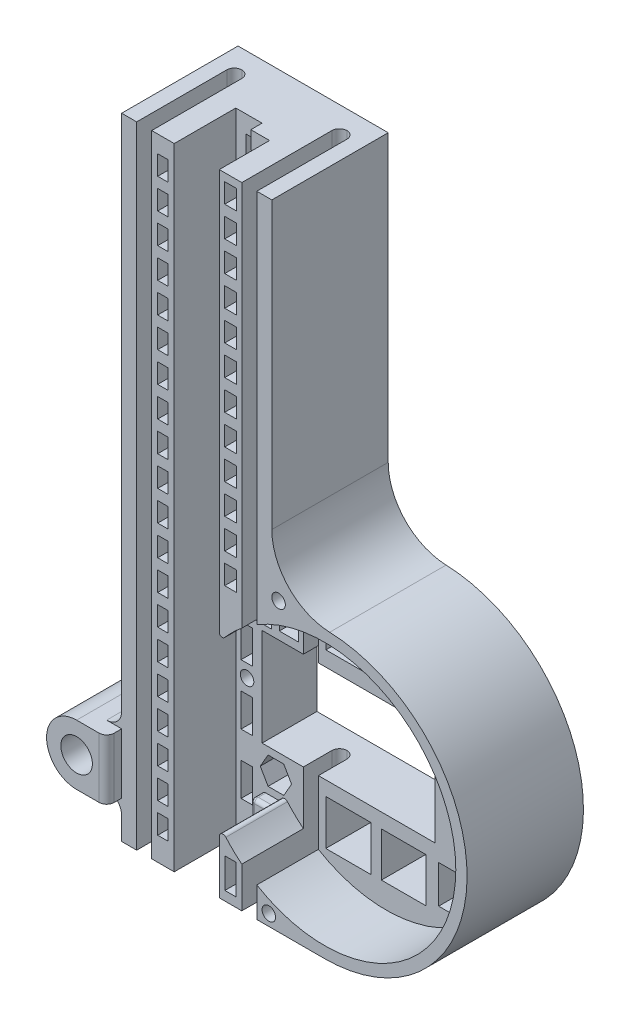
from build123d import *

# Parameters (mm, degrees)
BODYBASE_R                            = 19
BODY_DEPTH                            = 7.75
SERVOLOCH_W                           = 23
SERVOLOCH_H                           = 13
SERVO_LOCH_DEPTH                      = 73.974310548
ZAHRADLAUF_R                          = 17.5
ZAHNRAD_LAUF_DEPTH                    = 8.2
ZAHNSTANGENLAUF_W                     = 6
ZAHNSTANGENLAUF_H                     = 85
ZAHNSTANGEN_LAUF_DEPTH                = 8.2
SKIZZE5_W                             = 2.5
SKIZZE5_H                             = 7
FRONTFUEHRUNG_DEPTH                   = 1.5
SKIZZE2_W                             = 2.5
SKIZZE2_H                             = 53.958746969
AUFSATZ_LINEAR_AUSTRAGEN2_DEPTH       = 1.5
VERRUNDUNG22_R                        = 0.5
VERRUNDUNG13_R                        = 8
SKIZZEFURCHE_W                        = 2
SKIZZEFURCHE_H                        = 85
FURCHE_DEPTH                          = 13
GEGENSTUCKINNEN_W                     = 2
GEGENSTUCKINNEN_H                     = 4.6
GEGENSTUCK_INNEN_DEPTH                = 8
LINEARES_MUSTER1_COUNT                = 3
LINEARES_MUSTER1_PITCH                = 10
ANSATZ_DEPTH                          = 7.75
VERRUNDUNG14_R                        = 2
GEGENSTUCK2_W                         = 2
GEGENSTUCK2_H                         = 4.6
GEGENSTUCKAUSSEN_DEPTH                = 8
BUCKELMUSTER2_COUNT                   = 6
BUCKELMUSTER2_PITCH                   = 10
VERRUNDUNG15_R                        = 2
VERRUNDUNG21_R                        = 0.5
BOHRUNG_OBEN_R                        = 0.9
BOHRLOCHER_OBEN_DEPTH                 = 10
SKIZZE11_W                            = 1.4
SKIZZE11_H                            = 2.6
SCHNITT_LINEAR_AUSTRAGEN5_DEPTH       = 15
LINEARES_MUSTER3_COUNT                = 20
LINEARES_MUSTER3_PITCH                = 4
ANSATZ_OBEN_DEPTH                     = 2
VERRUNDUNG23_R                        = 2
VERRUNDUNG24_R                        = 2
VERRUNDUNG25_R                        = 1
SKIZZE16_R                            = 2.1
AUSSENBORDER_DEPTH                    = 77.728417315
SKIZZE17_W                            = 3.4
SKIZZE17_H                            = 2.6
SCHNITT_LINEAR_AUSTRAGEN7_DEPTH       = 8
LINEARES_MUSTER5_COUNT                = 13
LINEARES_MUSTER5_PITCH                = 4.4
SKIZZE18_W                            = 1.552843638
SKIZZE18_H                            = 2.6
SCHNITT_LINEAR_AUSTRAGEN8_DEPTH       = 14
LINEARES_MUSTER6_COUNT                = 12
LINEARES_MUSTER6_PITCH                = 4
SCHNITT_LINEAR_AUSTRAGEN10_DEPTH      = 6
VERRUNDUNG27_R                        = 0.4
VERRUNDUNG28_R                        = 0.4
SKIZZE24_W                            = 1.5
SKIZZE24_H                            = 4.4
SCHNITT_LINEAR_AUSTRAGEN11_DEPTH      = 6
LINEARES_MUSTER7_COUNT                = 3
LINEARES_MUSTER7_PITCH                = 8
VERRUNDUNG31_R                        = 1
VERRUNDUNG32_R                        = 1
VERRUNDUNG33_R                        = 1
VERRUNDUNG34_R                        = 1
VERRUNDUNG35_R                        = 1
SKIZZE26_W                            = 1.5
SKIZZE26_H                            = 4
SCHNITT_LINEAR_AUSTRAGEN13_DEPTH      = 13
SCHNITT_LINEAR_AUSTRAGEN14_DEPTH      = 77.728417292
SCHNITT_LINEAR_AUSTRAGEN14_DEPTH_BACK = 77.728417292
SKIZZE27_R                            = 0.9
VERRUNDUNG30_R                        = 0.5
SKIZZE29_W                            = 6
SKIZZE29_H                            = 6
SKIZZE29_W_2                          = 5.560018303
SKIZZE29_H_2                          = 6.236802283
SKIZZE29_W_3                          = 3.76587695
SKIZZE29_H_3                          = 4.832158239
SKIZZE29_W_4                          = 5.942855049
SKIZZE29_H_4                          = 5.908583954
SKIZZE29_W_5                          = 3.227027913
SKIZZE29_H_5                          = 5.038233608
SKIZZE29_W_6                          = 4.415287799
SKIZZE29_H_6                          = 13.001496805
SCHNITT_LINEAR_AUSTRAGEN15_DEPTH      = 6
SKIZZE30_W                            = 2.55244911
SKIZZE30_H                            = 2.728202153
SCHNITT_LINEAR_AUSTRAGEN16_DEPTH      = 7
SKIZZE31_W                            = 20
SKIZZE31_H                            = 1
SCHNITT_LINEAR_AUSTRAGEN17_DEPTH      = 77.297116743


with BuildPart() as part:
    # BodyBase → body (new, symmetric)
    with BuildSketch(Plane.XY):
        with BuildLine():
            Line((-7, 66), (-27, 66))
            Line((-27, 66), (-27, -19))
            Line((-27, -19), (0, -19))
            ThreePointArc((0, -19), (-19, 0), (0, 19))
            Line((0, 19), (-7, 19))
            Line((-7, 19), (-7, 66))
        make_face()
        Circle(BODYBASE_R)
    extrude(amount=BODY_DEPTH, both=True)

    # ServoLoch → servo_loch (cut, through all)
    with BuildSketch(Plane.XY.offset(7.75)):
        with Locations((-5, 0)):
            Rectangle(SERVOLOCH_W, SERVOLOCH_H)
    extrude(amount=-SERVO_LOCH_DEPTH, mode=Mode.SUBTRACT)

    # Zahradlauf → zahnrad_lauf (cut)
    with BuildSketch(Plane.XY.offset(7.75)):
        Circle(ZAHRADLAUF_R)
    extrude(amount=-ZAHNRAD_LAUF_DEPTH, mode=Mode.SUBTRACT)

    # zahnstangenlauf → zahnstangen_lauf (cut)
    with BuildSketch(Plane.XY.offset(7.75)):
        with Locations((-17, 23.5)):
            Rectangle(ZAHNSTANGENLAUF_W, ZAHNSTANGENLAUF_H)
    extrude(amount=-ZAHNSTANGEN_LAUF_DEPTH, mode=Mode.SUBTRACT)

    # Skizze5 → frontfuehrung (add)
    with BuildSketch(Plane.XY.offset(-0.45)):
        with Locations((-15.25, -15.5)):
            Rectangle(SKIZZE5_W, SKIZZE5_H)
    extrude(amount=FRONTFUEHRUNG_DEPTH)

    # Skizze2 → Aufsatz-Linear austragen2 (add)
    with BuildSketch(Plane.XY.offset(-0.45)):
        with Locations((-15.25, 39.020626515)):
            Rectangle(SKIZZE2_W, SKIZZE2_H)
    extrude(amount=AUFSATZ_LINEAR_AUSTRAGEN2_DEPTH)

    # Verrundung22
    verrundung22_edges = [part.edges().sort_by_distance(p)[0] for p in [
        (-14, -10.5, 3.65),
    ]]
    fillet(verrundung22_edges, radius=VERRUNDUNG22_R)

    # Verrundung13
    verrundung13_edges = [part.edges().sort_by_distance(p)[0] for p in [
        (-7, 19, 0),
    ]]
    fillet(verrundung13_edges, radius=VERRUNDUNG13_R)

    # SkizzeFurche → Furche (cut)
    with BuildSketch(Plane.XY.offset(7.75)):
        with Locations((-24, 23.5)):
            Rectangle(SKIZZEFURCHE_W, SKIZZEFURCHE_H)
        with Locations((-10, 23.5)):
            Rectangle(SKIZZEFURCHE_W, SKIZZEFURCHE_H)
    extrude(amount=-FURCHE_DEPTH, mode=Mode.SUBTRACT)

    # gegenstuckInnen → gegenstuck innen (add)
    with BuildSketch(Plane.XY.offset(-5.25)):
        with Locations((-10, 43.34)):
            Rectangle(GEGENSTUCKINNEN_W, GEGENSTUCKINNEN_H)
    gegenstuck_innen = extrude(amount=GEGENSTUCK_INNEN_DEPTH)

    # Lineares Muster1: gegenstuck innen ×3
    with Locations(*[(0, -i * LINEARES_MUSTER1_PITCH, 0) for i in range(1, LINEARES_MUSTER1_COUNT)]):
        add(gegenstuck_innen)

    # Verrundung14
    verrundung14_edges = [part.edges().sort_by_distance(p)[0] for p in [
        (-10, 41.04, 2.75),
        (-10, 45.64, 2.75),
        (-10, 31.04, 2.75),
        (-10, 35.64, 2.75),
        (-10, 21.04, 2.75),
        (-10, 25.64, 2.75),
    ]]
    fillet(verrundung14_edges, radius=VERRUNDUNG14_R)

    # gegenstuck2 → gegenstuckAussen (add)
    with BuildSketch(Plane.XY.offset(-5.25)):
        with Locations((-24, 43.55)):
            Rectangle(GEGENSTUCK2_W, GEGENSTUCK2_H)
    gegenstuckaussen = extrude(amount=GEGENSTUCKAUSSEN_DEPTH)

    # buckelmuster2: gegenstuckAussen ×6
    with Locations(*[(0, -i * BUCKELMUSTER2_PITCH, 0) for i in range(1, BUCKELMUSTER2_COUNT)]):
        add(gegenstuckaussen)

    # Verrundung15
    verrundung15_edges = [part.edges().sort_by_distance(p)[0] for p in [
        (-24, 41.25, 2.75),
        (-24, 45.85, 2.75),
        (-24, 31.25, 2.75),
        (-24, 35.85, 2.75),
        (-24, 21.25, 2.75),
        (-24, 25.85, 2.75),
        (-24, 11.25, 2.75),
        (-24, 15.85, 2.75),
        (-24, 1.25, 2.75),
        (-24, 5.85, 2.75),
        (-24, -8.75, 2.75),
        (-24, -4.15, 2.75),
    ]]
    fillet(verrundung15_edges, radius=VERRUNDUNG15_R)

    # Verrundung21
    verrundung21_edges = [part.edges().sort_by_distance(p)[0] for p in [
        (-15.25, -12, 1.05),
    ]]
    fillet(verrundung21_edges, radius=VERRUNDUNG21_R)

    # bohrung oben → bohrlocher oben (cut)
    with BuildSketch(Plane.XY.offset(7.75)):
        with Locations((-7.4, -17.5)):
            Circle(BOHRUNG_OBEN_R)
        with Locations((-6.1, 19.2)):
            Circle(BOHRUNG_OBEN_R)
    extrude(amount=-BOHRLOCHER_OBEN_DEPTH, mode=Mode.SUBTRACT)

    # Skizze11 → Schnitt-Linear austragen5 (cut)
    with BuildSketch(Plane.XY.offset(7.75)):
        with Locations((-21.5, 61.424327929)):
            Rectangle(SKIZZE11_W, SKIZZE11_H)
    schnitt_linear_austragen5 = extrude(amount=-SCHNITT_LINEAR_AUSTRAGEN5_DEPTH, mode=Mode.SUBTRACT)

    # Lineares Muster3: Schnitt-Linear austragen5 ×20
    with Locations(*[(0, -i * LINEARES_MUSTER3_PITCH, 0) for i in range(1, LINEARES_MUSTER3_COUNT)]):
        add(schnitt_linear_austragen5, mode=Mode.SUBTRACT)



with BuildPart() as body_2:
    # Skizze13 → Ansatz (new, symmetric)
    with BuildSketch(Plane.XY):
        with BuildLine():
            Line((-27, -14), (-31, -14))
            ThreePointArc((-31, -14), (-35, -10), (-31, -6))
            Line((-31, -6), (-27, -6))
            Line((-27, -6), (-27, -14))
        make_face()
    extrude(amount=ANSATZ_DEPTH, both=True)


with BuildPart() as part_1:
    add(part.part)

    add(body_2.part)  # Ansatz oben merges body 2
    # Skizze15 → Ansatz oben (add)
    with BuildSketch(Plane.XY.offset(7.75)):
        with BuildLine():
            Line((-27, -6), (-27, -14))
            Line((-27, -14), (-31, -14))
            ThreePointArc((-31, -14), (-35, -10), (-31, -6))
            Line((-31, -6), (-27, -6))
        make_face()
    extrude(amount=ANSATZ_OBEN_DEPTH)

    # Verrundung23
    verrundung23_edges = [part_1.edges().sort_by_distance(p)[0] for p in [
        (-27, -14, 0),
    ]]
    fillet(verrundung23_edges, radius=VERRUNDUNG23_R)

    # Verrundung24
    verrundung24_edges = [part_1.edges().sort_by_distance(p)[0] for p in [
        (-27, -6, 0),
    ]]
    fillet(verrundung24_edges, radius=VERRUNDUNG24_R)

    # Verrundung25
    verrundung25_edges = [part_1.edges().sort_by_distance(p)[0] for p in [
        (-27, -10, 9.75),
    ]]
    fillet(verrundung25_edges, radius=VERRUNDUNG25_R)

    # Skizze16 → aussenborder (cut, through all)
    with BuildSketch(Plane.XY.offset(9.75)):
        with Locations((-31, -10)):
            Circle(SKIZZE16_R)
    extrude(amount=-AUSSENBORDER_DEPTH, mode=Mode.SUBTRACT)

    # Skizze17 → Schnitt-Linear austragen7 (cut)
    with BuildSketch(Plane.XY.offset(1.05)):
        with Locations((-16.945790866, 61.378396545)):
            Rectangle(SKIZZE17_W, SKIZZE17_H)
    schnitt_linear_austragen7 = extrude(amount=-SCHNITT_LINEAR_AUSTRAGEN7_DEPTH, mode=Mode.SUBTRACT)

    # Lineares Muster5: Schnitt-Linear austragen7 ×13
    with Locations(*[(0, -i * LINEARES_MUSTER5_PITCH, 0) for i in range(1, LINEARES_MUSTER5_COUNT)]):
        add(schnitt_linear_austragen7, mode=Mode.SUBTRACT)

    # Skizze18 → Schnitt-Linear austragen8 (cut)
    with BuildSketch(Plane.XY.offset(7.75)):
        with Locations((-12.5, 62.665418705)):
            Rectangle(SKIZZE18_W, SKIZZE18_H)
    schnitt_linear_austragen8 = extrude(amount=-SCHNITT_LINEAR_AUSTRAGEN8_DEPTH, mode=Mode.SUBTRACT)

    # Lineares Muster6: Schnitt-Linear austragen8 ×12
    with Locations(*[(0, -i * LINEARES_MUSTER6_PITCH, 0) for i in range(1, LINEARES_MUSTER6_COUNT)]):
        add(schnitt_linear_austragen8, mode=Mode.SUBTRACT)

    # Skizze22 → Schnitt-Linear austragen10 (cut)
    with BuildSketch(Plane.XY.offset(-0.45)):
        Polygon((-12.569534262, -9.279382367), (-13.612986121, -7.472070732), (-15.699889838, -7.472070732), (-16.743341697, -9.279382367), (-15.699889838, -11.086694002), (-13.612986121, -11.086694002), align=None)
    extrude(amount=-SCHNITT_LINEAR_AUSTRAGEN10_DEPTH, mode=Mode.SUBTRACT)

    # Verrundung27
    verrundung27_edges = [part_1.edges().sort_by_distance(p)[0] for p in [
        (-14, 10.5, 3.65),
    ]]
    fillet(verrundung27_edges, radius=VERRUNDUNG27_R)

    # Verrundung28
    verrundung28_edges = [part_1.edges().sort_by_distance(p)[0] for p in [
        (-15.245790866, 12.041253031, 0.3),
    ]]
    fillet(verrundung28_edges, radius=VERRUNDUNG28_R)

    # Skizze24 → Schnitt-Linear austragen11 (cut)
    with BuildSketch(Plane.XY.offset(-0.45)):
        with Locations((-18.547351861, 3.91867336)):
            Rectangle(SKIZZE24_W, SKIZZE24_H)
    schnitt_linear_austragen11 = extrude(amount=-SCHNITT_LINEAR_AUSTRAGEN11_DEPTH, mode=Mode.SUBTRACT)

    # Lineares Muster7: Schnitt-Linear austragen11 ×3
    with Locations(*[(0, -i * LINEARES_MUSTER7_PITCH, 0) for i in range(1, LINEARES_MUSTER7_COUNT)]):
        add(schnitt_linear_austragen11, mode=Mode.SUBTRACT)

    # Verrundung31
    verrundung31_edges = [part_1.edges().sort_by_distance(p)[0] for p in [
        (-25, 55.925, -5.25),
    ]]
    fillet(verrundung31_edges, radius=VERRUNDUNG31_R)

    # Verrundung32
    verrundung32_edges = [part_1.edges().sort_by_distance(p)[0] for p in [
        (-23, 55.925, -5.25),
    ]]
    fillet(verrundung32_edges, radius=VERRUNDUNG32_R - 0.0001)  # a hair under: the kernel refuses the full size

    # Verrundung33
    verrundung33_edges = [part_1.edges().sort_by_distance(p)[0] for p in [
        (-9, 55.82, -5.25),
        (-11, 55.82, -5.25),
    ]]
    fillet(verrundung33_edges, radius=VERRUNDUNG33_R - 0.0001)  # a hair under: the kernel refuses the full size

    # Verrundung34
    verrundung34_edges = [part_1.edges().sort_by_distance(p)[0] for p in [
        (-9, -12.75, -5.25),
        (-11, -12.75, -5.25),
        (-23, -13.875, -5.25),
        (-25, -13.875, -5.25),
    ]]
    fillet(verrundung34_edges, radius=VERRUNDUNG34_R - 0.0001)  # a hair under: the kernel refuses the full size

    # Verrundung35
    verrundung35_edges = [part_1.edges().sort_by_distance(p)[0] for p in [
        (-11, 38.34, -5.25),
        (-9, 38.34, -5.25),
        (-9, 28.34, -5.25),
        (-11, 28.34, -5.25),
        (-23, 38.55, -5.25),
        (-25, 38.55, -5.25),
        (-23, 28.55, -5.25),
        (-25, 28.55, -5.25),
        (-23, 18.55, -5.25),
        (-25, 18.55, -5.25),
        (-25, 8.55, -5.25),
        (-23, 8.55, -5.25),
        (-23, -1.45, -5.25),
        (-25, -1.45, -5.25),
        (-9, 13.77, -5.25),
        (-11, 13.77, -5.25),
    ]]
    fillet(verrundung35_edges, radius=VERRUNDUNG35_R - 0.0001)  # a hair under: the kernel refuses the full size

    # Skizze26 → Schnitt-Linear austragen13 (cut)
    with BuildSketch(Plane.XY.offset(7.75)):
        with Locations((-12.50556405, -15.775604521)):
            Rectangle(SKIZZE26_W, SKIZZE26_H)
    extrude(amount=-SCHNITT_LINEAR_AUSTRAGEN13_DEPTH, mode=Mode.SUBTRACT)

    # Skizze27 → Schnitt-Linear austragen14 (cut, two sides: drawn at the far end of the back side and taken through both)
    with BuildSketch(Plane(origin=(0, 0, -7.75), x_dir=(-1, 0, 0), z_dir=(0, 0, -1)).offset(-SCHNITT_LINEAR_AUSTRAGEN14_DEPTH_BACK)):
        with Locations(Location((-8.5, 0, 0), (0, 0, 180))):
            Circle(SKIZZE27_R)
        with Locations(Location((18.5, 0, 0), (0, 0, 180))):
            Circle(SKIZZE27_R)
    extrude(amount=SCHNITT_LINEAR_AUSTRAGEN14_DEPTH + SCHNITT_LINEAR_AUSTRAGEN14_DEPTH_BACK, mode=Mode.SUBTRACT)

    # Verrundung30
    verrundung30_edges = [part_1.edges().sort_by_distance(p)[0] for p in [
        (-16.5, -15.75, 1.05),
        (-16.5, -12, 0.05),
        (-16.5, -12.146446609, 0.903553391),
    ]]
    fillet(verrundung30_edges, radius=VERRUNDUNG30_R)

    # Skizze29 → Schnitt-Linear austragen15 (cut)
    with BuildSketch(Plane.XY.offset(-0.45)):
        with Locations((-5, 11.5)):
            Rectangle(SKIZZE29_W, SKIZZE29_H)
        with Locations((-5.016988767, -11.410701403)):
            Rectangle(SKIZZE29_W, SKIZZE29_H)
        with Locations((2.227219929, 11.56498537)):
            Rectangle(SKIZZE29_W_2, SKIZZE29_H_2)
        with Locations((9.124332043, 10.811976889)):
            Rectangle(SKIZZE29_W_3, SKIZZE29_H_3)
        with Locations((2.364271099, -11.39945684)):
            Rectangle(SKIZZE29_W_4, SKIZZE29_H_4)
        with Locations((8.630140062, -11.030317749)):
            Rectangle(SKIZZE29_W_5, SKIZZE29_H_5)
        with Locations((13.019517956, 0.038707174)):
            Rectangle(SKIZZE29_W_6, SKIZZE29_H_6)
    extrude(amount=-SCHNITT_LINEAR_AUSTRAGEN15_DEPTH, mode=Mode.SUBTRACT)

    # Skizze30 → Schnitt-Linear austragen16 (cut)
    with BuildSketch(Plane.XY.offset(-0.45)):
        with Locations((-12.926476176, 8.942620089)):
            Rectangle(SKIZZE30_W, SKIZZE30_H)
    extrude(amount=-SCHNITT_LINEAR_AUSTRAGEN16_DEPTH, mode=Mode.SUBTRACT)

    # Skizze31 → Schnitt-Linear austragen17 (cut, through all)
    with BuildSketch(Plane.XY.offset(7.75)):
        with Locations((-17, 65.5)):
            Rectangle(SKIZZE31_W, SKIZZE31_H)
    extrude(amount=-SCHNITT_LINEAR_AUSTRAGEN17_DEPTH, mode=Mode.SUBTRACT)


solid = part_1.part
